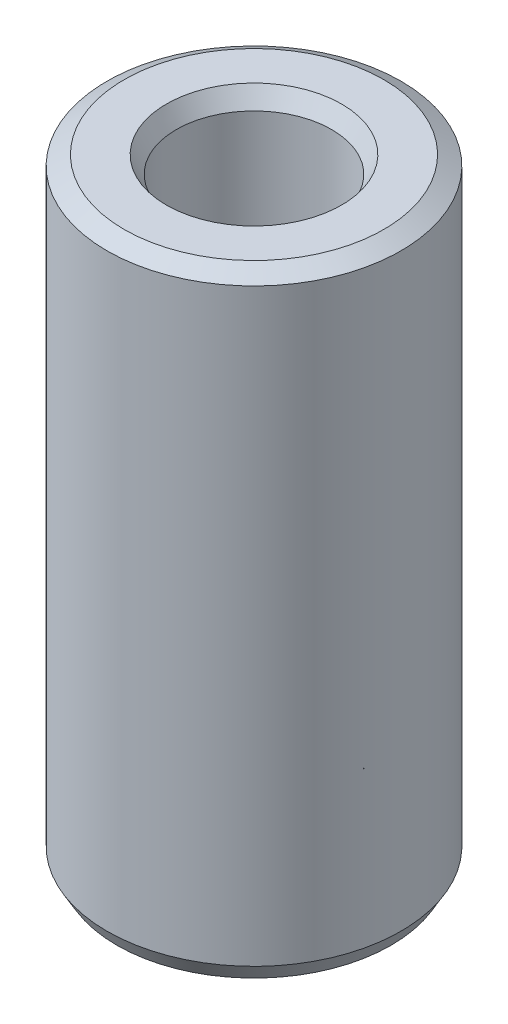
from build123d import *
from OCP.BRepFilletAPI import BRepFilletAPI_MakeChamfer

# Parameters (mm, degrees)
SKETCH1_R           = 27.5
BOSS_EXTRUDE1_DEPTH = 115.309120199
SKETCH2_R           = 14.536345259
CUT_EXTRUDE1_DEPTH  = 122.690974197
CHAMFER1_SIZE       = 1.85398206
CHAMFER1_SIZE2      = 3.211191125


with BuildPart() as part:
    # Sketch1 → Boss-Extrude1 (new body)
    with BuildSketch(Plane(origin=(0, 0, 0), x_dir=(1, 0, 0), z_dir=(0, 1, 0))):
        Circle(SKETCH1_R)
    extrude(amount=BOSS_EXTRUDE1_DEPTH)

    # Sketch2 → Cut-Extrude1 (cut, through all)
    with BuildSketch(Plane(origin=(0, 0, 0), x_dir=(1, 0, 0), z_dir=(0, 1, 0))):
        Circle(SKETCH2_R)
    extrude(amount=CUT_EXTRUDE1_DEPTH, mode=Mode.SUBTRACT)

    # Chamfer1: one chamfer whose edges measure the first distance from different faces: ONE call of the kernel's chamfer builder (chamfer() names one face for all edges)
    chamfer1_edges_1 = [part.edges().sort_by_distance(p)[0] for p in [
        (-14.536345259, 115.309120199, 0),
    ]]
    chamfer1_side_1 = [part.faces().sort_by_distance(p)[0] for p in [
        (-26.722182541, 115.309120199, 0),
    ]]
    chamfer1_edges_2 = [part.edges().sort_by_distance(p)[0] for p in [
        (-14.536345259, 0, 0),
    ]]
    chamfer1_side_2 = [part.faces().sort_by_distance(p)[0] for p in [
        (-14.536345259, 57.654560099, 0),
    ]]
    chamfer1_edges_3 = [part.edges().sort_by_distance(p)[0] for p in [
        (-27.5, 0, 0),
    ]]
    chamfer1_side_3 = [part.faces().sort_by_distance(p)[0] for p in [
        (-26.722182541, 0, 0),
    ]]
    chamfer1_edges_4 = [part.edges().sort_by_distance(p)[0] for p in [
        (-27.5, 115.309120199, 0),
    ]]
    chamfer1_side_4 = [part.faces().sort_by_distance(p)[0] for p in [
        (-27.5, 57.654560099, 0),
    ]]
    chamfer1 = BRepFilletAPI_MakeChamfer(part.part.solid().wrapped)
    for e in chamfer1_edges_1:
        chamfer1.Add(CHAMFER1_SIZE, CHAMFER1_SIZE2, e.wrapped, chamfer1_side_1[0].wrapped)  # the first distance lies on this face
    for e in chamfer1_edges_2:
        chamfer1.Add(CHAMFER1_SIZE, CHAMFER1_SIZE2, e.wrapped, chamfer1_side_2[0].wrapped)  # the first distance lies on this face
    for e in chamfer1_edges_3:
        chamfer1.Add(CHAMFER1_SIZE, CHAMFER1_SIZE2, e.wrapped, chamfer1_side_3[0].wrapped)  # the first distance lies on this face
    for e in chamfer1_edges_4:
        chamfer1.Add(CHAMFER1_SIZE, CHAMFER1_SIZE2, e.wrapped, chamfer1_side_4[0].wrapped)  # the first distance lies on this face
    add(Compound.cast(chamfer1.Shape()), mode=Mode.REPLACE)


solid = part.part
